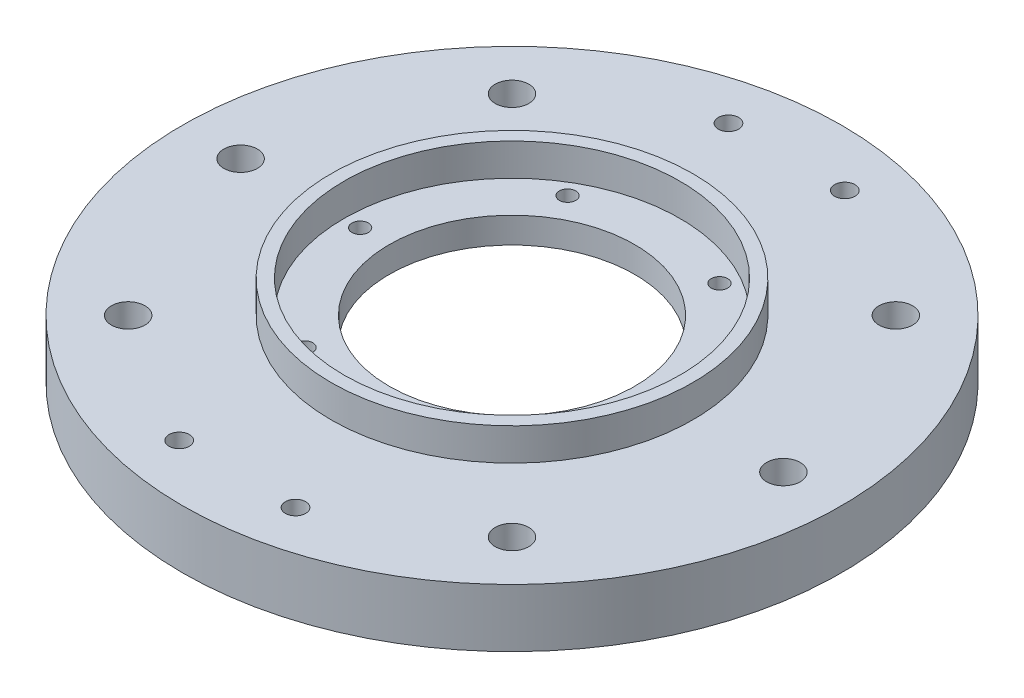
from build123d import *

# Parameters (mm, degrees)
SKETCH_1_R                  = 51
SKETCH_1_R_2                = 19
EXTRUDE_1_DEPTH             = 4
PATTERN_CIRCULAR_1_COUNT    = 6
HOLE_WIZARD_M32_D           = 3.15
PATTERN_LINEAR_1_COUNT      = 2
PATTERN_LINEAR_1_PITCH      = 18
PATTERN_LINEAR_1_COUNT_DIR2 = 2
PATTERN_LINEAR_1_PITCH_DIR2 = 85
HOLE_WIZARD_M52_D           = 5.2
PATTERN_CIRCULAR_3_COUNT    = 2
PATTERN_CIRCULAR_3_ANGLE    = 45
F_3_THE_OTHER_WAY_COUNT     = 2
F_3_THE_OTHER_WAY_ANGLE     = 45
SKETCH_14_R                 = 28
SKETCH_14_R_2               = 26
EXTRUDE_2_DEPTH             = 5
EXTRUDE_START               = 5
SKETCH_15_R                 = 51
SKETCH_15_R_2               = 48
EXTRUDE_3_DEPTH             = 5


with BuildPart() as part:
    # Эскиз1 → Бобышка-Вытянуть1 (new body)
    with BuildSketch(Plane(origin=(0, 0, 0), x_dir=(1, 0, 0), z_dir=(0, 1, 0))):
        Circle(SKETCH_1_R)
        Circle(SKETCH_1_R_2, mode=Mode.SUBTRACT)
    extrude(amount=EXTRUDE_1_DEPTH)

    # Эскиз3 → Сверло под метчик  спиральное M2.51 (revolve, cut)
    with BuildSketch(Plane(origin=(23.5, 4, 0), x_dir=(0, 0, 1), z_dir=(1, 0, 0))):
        Polygon((0, 0), (0, 8.766097289), (1.275, 8), (1.275, 0), align=None)
    hole_wizard_m2_51 = revolve(axis=Axis((23.5, 10.35, 0), (0, -1, 0)), mode=Mode.SUBTRACT)

    # Круговой массив1: Сверло под метчик  спиральное M2.51 ×6 about axis
    pattern_circular_1_axis = Axis((0, 4, 0), (0, 1, 0))
    for i in range(1, PATTERN_CIRCULAR_1_COUNT):
        add(hole_wizard_m2_51.rotate(pattern_circular_1_axis, i * 360 / PATTERN_CIRCULAR_1_COUNT), mode=Mode.SUBTRACT)

    # Сверло под метчик  спиральное M32 (through all)
    with Locations(Plane(origin=(0, 0, 0), x_dir=(-1, 0, 0), z_dir=(0, -1, 0))):
        with Locations((-9, -42.5)):
            hole_wizard_m32 = Hole(HOLE_WIZARD_M32_D / 2)

    # Линейный массив1: Hole Wizard M32 2 × 2
    with Locations(*[(-i * PATTERN_LINEAR_1_PITCH, 0, -j * PATTERN_LINEAR_1_PITCH_DIR2) for i in range(PATTERN_LINEAR_1_COUNT) for j in range(PATTERN_LINEAR_1_COUNT_DIR2) if (i, j) != (0, 0)]):
        add(hole_wizard_m32, mode=Mode.SUBTRACT)

    # Сверло под метчик  спиральное M52 (through all)
    with Locations(Plane(origin=(0, 0, 0), x_dir=(-1, 0, 0), z_dir=(0, -1, 0))):
        with Locations((42, 0), (-42, 0)):
            hole_wizard_m52 = Hole(HOLE_WIZARD_M52_D / 2)

    # Круговой массив3: Сверло под метчик  спиральное M52 ×2 about axis
    pattern_circular_3_axis = Axis((0, 0, 0), (0, 1, 0))
    for i in range(1, PATTERN_CIRCULAR_3_COUNT):
        add(hole_wizard_m52.rotate(pattern_circular_3_axis, i * PATTERN_CIRCULAR_3_ANGLE / (PATTERN_CIRCULAR_3_COUNT - 1)), mode=Mode.SUBTRACT)

    # 3 the other way: Сверло под метчик  спиральное M52 ×2 about axis
    f_3_the_other_way_axis = Axis((0, 0, 0), (0, -1, 0))
    for i in range(1, F_3_THE_OTHER_WAY_COUNT):
        add(hole_wizard_m52.rotate(f_3_the_other_way_axis, i * F_3_THE_OTHER_WAY_ANGLE / (F_3_THE_OTHER_WAY_COUNT - 1)), mode=Mode.SUBTRACT)

    # Эскиз14 → Бобышка-Вытянуть2 (add)
    with BuildSketch(Plane(origin=(0, 4, 0), x_dir=(1, 0, 0), z_dir=(0, 1, 0))):
        Circle(SKETCH_14_R)
        Circle(SKETCH_14_R_2, mode=Mode.SUBTRACT)
    extrude(amount=EXTRUDE_2_DEPTH)

    # Эскиз15 → Бобышка-Вытянуть3 (add)
    with BuildSketch(Plane.XZ.offset(EXTRUDE_START)):
        Circle(SKETCH_15_R)
        Circle(SKETCH_15_R_2, mode=Mode.SUBTRACT)
    extrude(amount=-EXTRUDE_3_DEPTH)


solid = part.part
